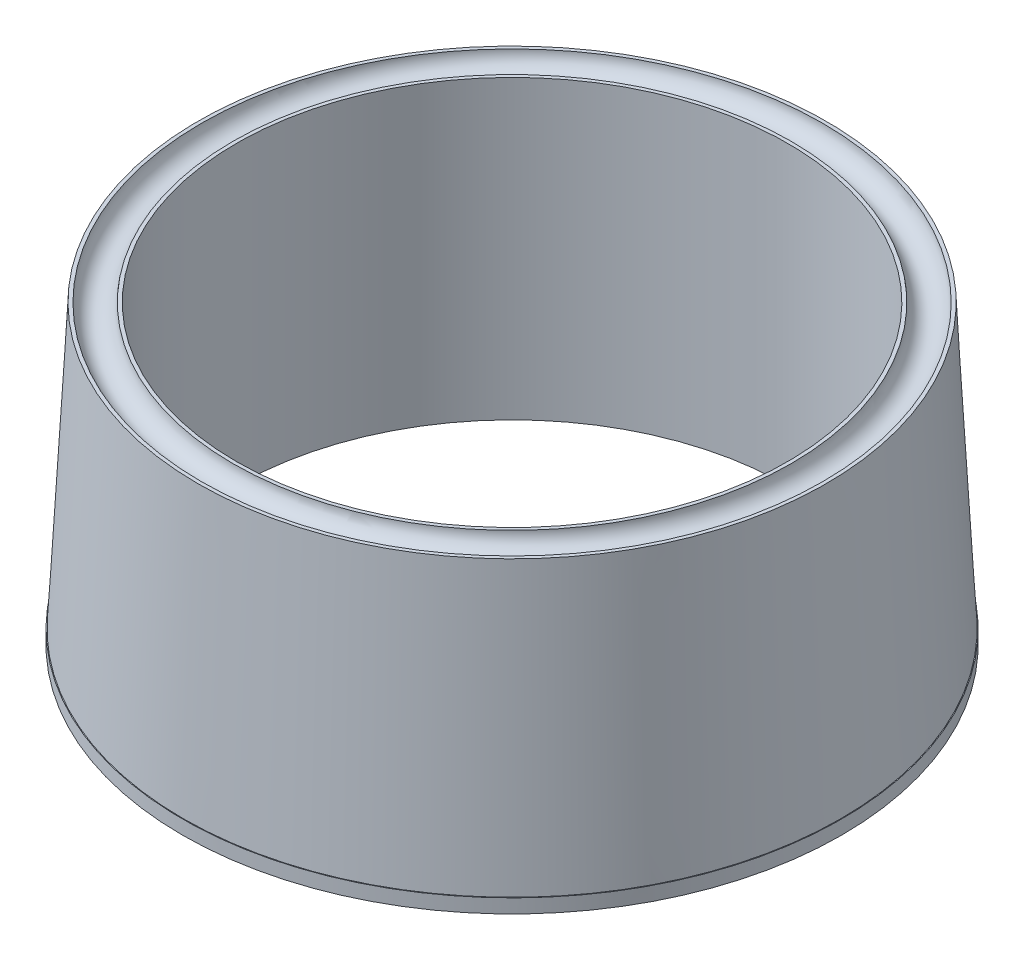
from build123d import *

# Parameters (mm, degrees)
SKETCH1_R            = 45
BOSS_EXTRUDE1_DEPTH  = 42.5
SKETCH2_R            = 39.5
CUT_EXTRUDE1_DEPTH   = 148
DRAFT2_ANGLE         = 3
CUT_EXTRUDE2_DEPTH   = 5
SKETCH7_R            = 47.22733062
BOSS_EXTRUDE2_DEPTH  = 2
SKETCH8_R            = 39.5
CUT_EXTRUDE3_DEPTH   = 66
SKETCH9_R            = 1.6
CUT_EXTRUDE4_DEPTH   = 15
CUT_SWEEP1_PROFILE_R = 2.25


with BuildPart() as part:
    # Sketch1 → Boss-Extrude1 (new body)
    with BuildSketch(Plane(origin=(0, 0, 0), x_dir=(1, 0, 0), z_dir=(0, 1, 0))):
        Circle(SKETCH1_R)
    extrude(amount=BOSS_EXTRUDE1_DEPTH)

    # Sketch2 → Cut-Extrude1 (cut)
    with BuildSketch(Plane(origin=(0, 42.5, 0), x_dir=(1, 0, 0), z_dir=(0, 1, 0))):
        Circle(SKETCH2_R)
    extrude(amount=-CUT_EXTRUDE1_DEPTH, mode=Mode.SUBTRACT)

    # Draft2
    draft2_faces = [part.faces().sort_by_distance(p)[0] for p in [
        (-45, 21.25, 0),
    ]]
    draft(draft2_faces, Plane.ZX.offset(42.5), DRAFT2_ANGLE)

    # Sketch6 → Cut-Extrude2 (cut)
    with BuildSketch(Plane.XZ):
        Polygon((-40.485053641, 1.661967222), (-43.36366531, 3.323934444), (-46.242276979, 1.661967222), (-46.242276979, -1.661967222), (-43.36366531, -3.323934444), (-40.485053641, -1.661967222), align=None)
        Polygon((-21.681832655, -34.474886348), (-24.348454268, -36.014461054), (-24.348454268, -39.093610465), (-21.681832655, -40.633185171), (-19.015211042, -39.093610465), (-19.015211042, -36.014461054), align=None)
        Polygon((-24.387760102, 35.991767819), (-21.681832655, 34.429499879), (-18.975905208, 35.991767819), (-18.975905208, 39.1163037), (-21.681832655, 40.67857164), (-24.387760102, 39.1163037), align=None)
        Polygon((19.305812767, -36.182240038), (19.305812767, -38.925831481), (21.681832655, -40.297627203), (24.057852543, -38.925831481), (24.057852543, -36.182240038), (21.681832655, -34.810444316), align=None)
        Polygon((19.015211042, 39.093610465), (19.015211042, 36.014461054), (21.681832655, 34.474886348), (24.348454268, 36.014461054), (24.348454268, 39.093610465), (21.681832655, 40.633185171), align=None)
        Polygon((40.948339588, -1.394488956), (43.36366531, -2.788977912), (45.778991032, -1.394488956), (45.778991032, 1.394488956), (43.36366531, 2.788977912), (40.948339588, 1.394488956), align=None)
    extrude(amount=-CUT_EXTRUDE2_DEPTH, mode=Mode.SUBTRACT)

    # Sketch7 → Boss-Extrude2 (add)
    with BuildSketch(Plane.XZ):
        Circle(SKETCH7_R)
    extrude(amount=-BOSS_EXTRUDE2_DEPTH)

    # Sketch8 → Cut-Extrude3 (cut)
    with BuildSketch(Plane(origin=(0, 2, 0), x_dir=(1, 0, 0), z_dir=(0, 1, 0))):
        Circle(SKETCH8_R)
    extrude(amount=-CUT_EXTRUDE3_DEPTH, mode=Mode.SUBTRACT)

    # Sketch9 → Cut-Extrude4 (cut)
    with BuildSketch(Plane.XZ):
        with Locations((-43.285053641, 0)):
            Circle(SKETCH9_R)
        with Locations((-21.64252682, -37.485956057)):
            Circle(SKETCH9_R)
        with Locations((-21.64252682, 37.485956057)):
            Circle(SKETCH9_R)
        with Locations((21.64252682, -37.485956057)):
            Circle(SKETCH9_R)
        with Locations((21.64252682, 37.485956057)):
            Circle(SKETCH9_R)
        with Locations((43.285053641, 0)):
            Circle(SKETCH9_R)
    extrude(amount=-CUT_EXTRUDE4_DEPTH, mode=Mode.SUBTRACT)

    # Cut-Sweep1: sweep along a path in Sketch10
    with BuildLine(Plane(origin=(0, 42.5, 0), x_dir=(1, 0, 0), z_dir=(0, 1, 0))) as cut_sweep1_path:
        CenterArc((0, 0), 42.25, 0, 360)
    # Cut-Sweep1 profile (on start of the path) → Cut-Sweep1 (sweep, cut)
    with BuildSketch(Plane(origin=(42.25, 42.5, 0), x_dir=(-1, 0, 0), z_dir=(0, 0, -1))):
        Circle(CUT_SWEEP1_PROFILE_R)
    sweep(path=cut_sweep1_path.line, mode=Mode.SUBTRACT)


solid = part.part
